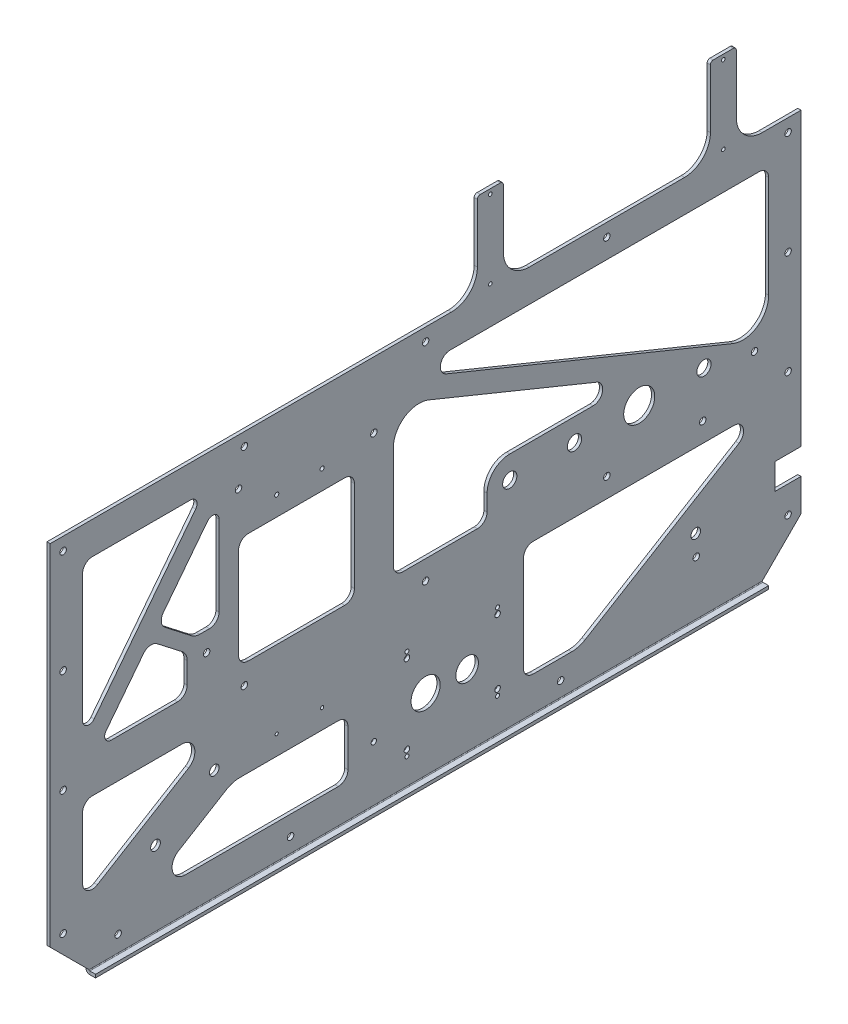
from build123d import *

# Parameters (mm, degrees)
BASE_FLANGE1_DEPTH = 3.175
SKETCH10_W         = 25.4
SKETCH10_H         = 85.725
TAB1_DEPTH         = 3.175
SKETCH6_R          = 4.7625
SKETCH6_R_2        = 14.2875
SKETCH6_R_3        = 3.175
CUT_EXTRUDE1_DEPTH = 595.54789231
SKETCH7_R          = 3.175
SKETCH7_R_2        = 2.032
SKETCH7_R_3        = 6.985
SKETCH7_R_4        = 1.5875
SKETCH7_R_5        = 15.24
SKETCH7_R_6        = 1.7859375
SKETCH7_W          = 25.4
SKETCH7_H          = 25.4
CUT_EXTRUDE2_DEPTH = 595.54789231
SKETCH8_R          = 1.951379357
SKETCH8_R_2        = 2.726079357
SKETCH8_R_3        = 11.1125
CUT_EXTRUDE3_DEPTH = 595.54789231
SKETCH9_R          = 3.175
SKETCH9_R_2        = 4.7625
SKETCH9_R_3        = 2.6035
CUT_EXTRUDE4_DEPTH = 595.54789231
FILLET2_R          = 2.794
FILLET3_R          = 25.4
CUT_EXTRUDE5_DEPTH = 595.54789231
EDGE_FLANGE1_DEPTH = 660.4


# Sheet-metal steps are written as plain solids
with BuildPart() as part:
    # Base-Flange1: sheet metal written as solids
    # Sketch1 → Base-Flange1 (new body)
    with BuildSketch(Plane(origin=(0, 0, 0), x_dir=(0, 0, -1), z_dir=(1, 0, 0))):
        Polygon((330.2, 0), (-330.2, 0), (-368.3, 38.1), (-368.3, 381), (368.3, 381), (368.3, 38.1), align=None)
    extrude(amount=-BASE_FLANGE1_DEPTH)

    # Tab1: sheet metal written as solids
    # Sketch10 → Tab1 (add)
    with BuildSketch(Plane(origin=(0, 0, 0), x_dir=(0, 0, -1), z_dir=(1, 0, 0))):
        with Locations((292.1, 423.8625)):
            Rectangle(SKETCH10_W, SKETCH10_H)
        with Locations((63.5, 423.8625)):
            Rectangle(SKETCH10_W, SKETCH10_H)
    extrude(amount=-TAB1_DEPTH)

    # Sketch6 → Cut-Extrude1 (cut, through all)
    with BuildSketch(Plane(origin=(0, 0, 0), x_dir=(0, 0, -1), z_dir=(1, 0, 0))):
        with Locations((264.979179141, 73.025)):
            Circle(SKETCH6_R)
        with Locations((0, 69.85)):
            Circle(SKETCH6_R_2)
        with Locations((-264.979179141, 73.025)):
            Circle(SKETCH6_R)
        with Locations((132.489589571, 14.2875)):
            Circle(SKETCH6_R_3)
        with Locations((-132.489589571, 14.2875)):
            Circle(SKETCH6_R_3)
    extrude(amount=-CUT_EXTRUDE1_DEPTH, mode=Mode.SUBTRACT)

    # Sketch7 → Cut-Extrude2 (cut, through all)
    with BuildSketch(Plane(origin=(0, 0, 0), x_dir=(0, 0, -1), z_dir=(1, 0, 0))):
        with Locations((355.6, 43.360512242)):
            Circle(SKETCH7_R)
        with Locations((355.6, 165.1)):
            Circle(SKETCH7_R)
        with Locations((177.8, 165.1)):
            Circle(SKETCH7_R)
        with Locations((0, 165.1)):
            Circle(SKETCH7_R)
        with Locations((-177.8, 165.1)):
            Circle(SKETCH7_R)
        with Locations((-355.6, 43.360512242)):
            Circle(SKETCH7_R)
        with Locations((-355.6, 165.1)):
            Circle(SKETCH7_R)
        with Locations((-301.625, 15.875)):
            Circle(SKETCH7_R)
        with Locations((-214.833393668, 211.619209216)):
            Circle(SKETCH7_R)
        with Locations((-101.6, 311.4675)):
            Circle(SKETCH7_R_2)
        with Locations((-146.05, 311.4675)):
            Circle(SKETCH7_R_2)
        with Locations((82.55, 209.55)):
            Circle(SKETCH7_R_3)
        with Locations((-146.05, 108.2675)):
            Circle(SKETCH7_R_4)
        with Locations((-101.6, 108.2675)):
            Circle(SKETCH7_R_4)
        with Locations((273.05, 209.55)):
            Circle(SKETCH7_R_3)
        with Locations((209.55, 209.55)):
            Circle(SKETCH7_R_5)
        with Locations((146.05, 209.55)):
            Circle(SKETCH7_R_3)
        with Locations((265.525, 52.775)):
            Circle(SKETCH7_R)
        with Locations((271.875, 165.10000014)):
            Circle(SKETCH7_R)
        with Locations((63.5, 461.9625)):
            Circle(SKETCH7_R_6)
        with Locations((-50.8, 316.23)):
            Circle(SKETCH7_R)
        with Locations((355.6, 266.7)):
            Circle(SKETCH7_R)
        with Locations((355.6, 368.3)):
            Circle(SKETCH7_R)
        with Locations((177.8, 368.3)):
            Circle(SKETCH7_R)
        with Locations((0, 368.3)):
            Circle(SKETCH7_R)
        with Locations((-177.8, 368.3)):
            Circle(SKETCH7_R)
        with Locations((-355.6, 368.3)):
            Circle(SKETCH7_R)
        with Locations((-355.6, 266.7)):
            Circle(SKETCH7_R)
        with Locations((322.675, 198.825)):
            Circle(SKETCH7_R)
        with Locations((292.1, 461.9625)):
            Circle(SKETCH7_R_6)
        with Locations((63.5, 385.7625)):
            Circle(SKETCH7_R_6)
        with Locations((292.1, 385.7625)):
            Circle(SKETCH7_R_6)
        with Locations((355.6, 82.55)):
            Rectangle(SKETCH7_W, SKETCH7_H)
    extrude(amount=-CUT_EXTRUDE2_DEPTH, mode=Mode.SUBTRACT)

    # Sketch8 → Cut-Extrude3 (cut, through all)
    with BuildSketch(Plane(origin=(0, 0, 0), x_dir=(0, 0, -1), z_dir=(1, 0, 0))):
        with Locations((70.587936913, 107.442)):
            Circle(SKETCH8_R)
        with Locations((70.587936913, 101.6)):
            Circle(SKETCH8_R_2)
        with Locations((-18.312063087, 114.427)):
            Circle(SKETCH8_R)
        with Locations((-18.312063087, 108.585)):
            Circle(SKETCH8_R_2)
        with Locations((-18.312063087, 31.115)):
            Circle(SKETCH8_R_2)
        with Locations((-18.312063087, 25.273)):
            Circle(SKETCH8_R)
        with Locations((70.587936913, 38.1)):
            Circle(SKETCH8_R_2)
        with Locations((70.587936913, 32.258)):
            Circle(SKETCH8_R)
        with Locations((40.7162, 69.85)):
            Circle(SKETCH8_R_3)
    extrude(amount=-CUT_EXTRUDE3_DEPTH, mode=Mode.SUBTRACT)

    # Sketch9 → Cut-Extrude4 (cut, through all)
    with BuildSketch(Plane(origin=(0, 0, 0), x_dir=(0, 0, -1), z_dir=(1, 0, 0))):
        with Locations((-183.534376043, 335.0500157)):
            Circle(SKETCH9_R)
        with Locations((-207.346876043, 108.0375157)):
            Circle(SKETCH9_R_2)
        with Locations((-50.8, 53.975)):
            Circle(SKETCH9_R_3)
    extrude(amount=-CUT_EXTRUDE4_DEPTH, mode=Mode.SUBTRACT)

    # Fillet2
    fillet2_edges = [part.edges().sort_by_distance(p)[0] for p in [
        (-1.5875, 466.725, -304.8),
        (-1.5875, 466.725, -279.4),
        (-1.5875, 466.725, -76.2),
        (-1.5875, 466.725, -50.8),
    ]]
    fillet(fillet2_edges, radius=FILLET2_R)

    # Fillet3
    fillet3_edges = [part.edges().sort_by_distance(p)[0] for p in [
        (-1.5875, 381, -304.8),
        (-1.5875, 381, -279.4),
        (-1.5875, 381, -76.2),
        (-1.5875, 381, -50.8),
    ]]
    fillet(fillet3_edges, radius=FILLET3_R)

    # Sketch11 → Cut-Extrude5 (cut, through all)
    with BuildSketch(Plane(origin=(0, 0, 0), x_dir=(0, 0, -1), z_dir=(1, 0, 0))):
        with BuildLine():
            Line((327.025, 349.25), (23.970213308, 349.25))
            ThreePointArc((23.970213308, 349.25), (14.623624103, 341.559910145), (20.36913166, 330.90695963))
            Line((20.36913166, 330.90695963), (301.547115604, 216.080440865))
            ThreePointArc((301.547115604, 216.080440865), (325.31415787, 218.511177814), (336.55, 239.595215184))
            Line((336.55, 239.595215184), (336.55, 339.725))
            ThreePointArc((336.55, 339.725), (333.760192091, 346.460192091), (327.025, 349.25))
        make_face()
        with BuildLine():
            Line((302.426875206, 146.05), (105.512936913, 146.05))
            ThreePointArc((105.512936913, 146.05), (98.777744823, 143.260192091), (95.987936913, 136.525))
            Line((95.987936913, 136.525), (95.987936913, 42.8625))
            ThreePointArc((95.987936913, 42.8625), (98.777744823, 36.127307909), (105.512936913, 33.3375))
            Line((105.512936913, 33.3375), (143.295855515, 33.3375))
            ThreePointArc((143.295855515, 33.3375), (150.12485752, 34.272734895), (156.450968109, 37.009568376))
            Line((156.450968109, 37.009568376), (307.360042429, 128.377025641))
            ThreePointArc((307.360042429, 128.377025641), (311.60116212, 139.085875752), (302.426875206, 146.05))
        make_face()
        with BuildLine():
            Line((-236.021315694, 33.3375), (-85.725, 33.3375))
            ThreePointArc((-85.725, 33.3375), (-78.989807909, 36.127307909), (-76.2, 42.8625))
            Line((-76.2, 42.8625), (-76.2, 79.6925))
            ThreePointArc((-76.2, 79.6925), (-78.989807909, 86.427692091), (-85.725, 89.2175))
            Line((-85.725, 89.2175), (-182.294371078, 89.2175))
            ThreePointArc((-182.294371078, 89.2175), (-189.141868765, 88.277094752), (-195.48232529, 85.525513813))
            Line((-195.48232529, 85.525513813), (-242.6152928, 56.891506906))
            ThreePointArc((-242.6152928, 56.891506906), (-248.25111307, 42.613751156), (-236.021315694, 33.3375))
        make_face()
        with BuildLine():
            Line((-322.07951717, 68.055561322), (-232.467919662, 122.495993094))
            ThreePointArc((-232.467919662, 122.495993094), (-226.832099393, 136.773748844), (-239.061896769, 146.05))
            Line((-239.061896769, 146.05), (-327.025, 146.05))
            ThreePointArc((-327.025, 146.05), (-333.760192091, 143.260192091), (-336.55, 136.525))
            Line((-336.55, 136.525), (-336.55, 76.196066502))
            ThreePointArc((-336.55, 76.196066502), (-331.695112474, 67.894519991), (-322.07951717, 68.055561322))
        make_face()
        with BuildLine():
            Line((-325.18085693, 210.489381593), (-225.577634519, 339.010179587))
            ThreePointArc((-225.577634519, 339.010179587), (-224.89489809, 345.694829188), (-230.596777589, 349.25))
            Line((-230.596777589, 349.25), (-327.025, 349.25))
            ThreePointArc((-327.025, 349.25), (-333.760192091, 346.460192091), (-336.55, 339.725))
            Line((-336.55, 339.725), (-336.55, 214.379202006))
            ThreePointArc((-336.55, 214.379202006), (-332.255594988, 208.371121676), (-325.18085693, 210.489381593))
        make_face()
        with BuildLine():
            Line((-255.646026892, 253.56438057), (-229.538235995, 233.330923076))
            ThreePointArc((-229.538235995, 233.330923076), (-225.869785145, 231.353048556), (-221.758595169, 230.669209216))
            Line((-221.758595169, 230.669209216), (-212.109376043, 230.669209216))
            ThreePointArc((-212.109376043, 230.669209216), (-205.374183952, 233.459017125), (-202.584376043, 240.194209216))
            Line((-202.584376043, 240.194209216), (-202.584376043, 319.020797994))
            ThreePointArc((-202.584376043, 319.020797994), (-206.878781055, 325.028878324), (-213.953519113, 322.910618407))
            Line((-213.953519113, 322.910618407), (-257.340010878, 266.927825794))
            ThreePointArc((-257.340010878, 266.927825794), (-259.260679011, 259.895267612), (-255.646026892, 253.56438057))
        make_face()
        with BuildLine():
            Line((-308.537598454, 184.15), (-243.408393668, 184.15))
            ThreePointArc((-243.408393668, 184.15), (-236.673201577, 186.939807909), (-233.883393668, 193.675))
            Line((-233.883393668, 193.675), (-233.883393668, 214.405900134))
            ThreePointArc((-233.883393668, 214.405900134), (-235.179634672, 219.99555851), (-238.803752842, 224.444186274))
            Line((-238.803752842, 224.444186274), (-263.425667718, 243.526094431))
            ThreePointArc((-263.425667718, 243.526094431), (-270.4582259, 245.446762564), (-276.789112942, 241.832110445))
            Line((-276.789112942, 241.832110445), (-313.556741524, 194.389820413))
            ThreePointArc((-313.556741524, 194.389820413), (-314.239477952, 187.705170812), (-308.537598454, 184.15))
        make_face()
        with BuildLine():
            Line((-183.534376043, 282.8925), (-183.534376043, 193.675))
            ThreePointArc((-183.534376043, 193.675), (-180.744568134, 186.939807909), (-174.009376043, 184.15))
            Line((-174.009376043, 184.15), (-79.375, 184.15))
            ThreePointArc((-79.375, 184.15), (-72.639807909, 186.939807909), (-69.85, 193.675))
            Line((-69.85, 193.675), (-69.85, 282.8925))
            ThreePointArc((-69.85, 282.8925), (-72.639807909, 289.627692091), (-79.375, 292.4175))
            Line((-79.375, 292.4175), (-174.009376043, 292.4175))
            ThreePointArc((-174.009376043, 292.4175), (-180.744568134, 289.627692091), (-183.534376043, 282.8925))
        make_face()
        with BuildLine():
            Line((-31.75, 293.804784816), (-31.75, 193.675))
            ThreePointArc((-31.75, 193.675), (-28.960192091, 186.939807909), (-22.225, 184.15))
            Line((-22.225, 184.15), (50.8, 184.15))
            ThreePointArc((50.8, 184.15), (57.535192091, 186.939807909), (60.325, 193.675))
            Line((60.325, 193.675), (60.325, 209.55))
            ThreePointArc((60.325, 209.55), (66.834551788, 225.265448212), (82.55, 231.775))
            Line((82.55, 231.775), (164.209500461, 231.775))
            ThreePointArc((164.209500461, 231.775), (173.556089665, 239.465089855), (167.810582109, 250.11804037))
            Line((167.810582109, 250.11804037), (3.252884396, 317.319559135))
            ThreePointArc((3.252884396, 317.319559135), (-20.51415787, 314.888822186), (-31.75, 293.804784816))
        make_face()
    extrude(amount=-CUT_EXTRUDE5_DEPTH, mode=Mode.SUBTRACT)

    # Edge-Flange1: sheet metal written as solids
    # Edge-Flange1 section (on a plane across the edge) → Edge-Flange1 (add)
    with BuildSketch(Plane(origin=(0, -0.7366, 330.2), x_dir=(0, 1, 0), z_dir=(0, 0, -1))):
        with BuildLine():
            Line((-3.175, 0.7366), (-3.175, 6.35))
            Line((-3.175, 6.35), (0, 6.35))
            Line((0, 6.35), (0, 0.7366))
            ThreePointArc((0, 0.7366), (0.215745145, 0.215745145), (0.7366, 0))
            Line((0.7366, 0), (0.7366, -3.175))
            ThreePointArc((0.7366, -3.175), (-2.029318885, -2.029318885), (-3.175, 0.7366))
        make_face()
    extrude(amount=EDGE_FLANGE1_DEPTH)


solid = part.part
